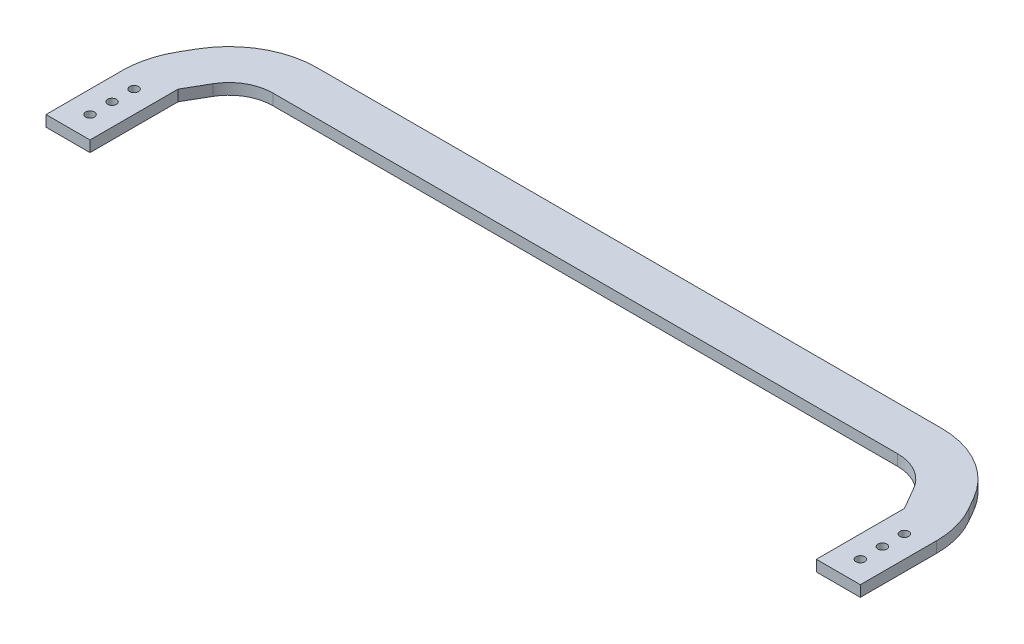
from build123d import *

# Parameters (mm, degrees)
BOSS_EXTRUDE1_DEPTH    = 6.35
F_10_CLEARANCE_HOLE1_D = 5.1054


with BuildPart() as part:
    # Sketch1 → Boss-Extrude1 (new body)
    with BuildSketch(Plane(origin=(0, 0, 0), x_dir=(1, 0, 0), z_dir=(0, 1, 0))):
        with BuildLine():
            Line((-209.55, -50.8), (-209.55, 0))
            Line((-209.55, 0), (-202.217651581, 12.7))
            ThreePointArc((-202.217651581, 12.7), (-192.920606325, 21.997045256), (-180.220606325, 25.4))
            Line((-180.220606325, 25.4), (180.220606325, 25.4))
            ThreePointArc((180.220606325, 25.4), (192.920606325, 21.997045256), (202.217651581, 12.7))
            Line((202.217651581, 12.7), (209.55, 0))
            Line((209.55, 0), (209.55, -50.8))
            Line((209.55, -50.8), (234.95, -50.8))
            Line((234.95, -50.8), (234.95, -6.805909488))
            ThreePointArc((234.95, -6.805909488), (233.219031975, 6.342098003), (228.144090512, 18.594090512))
            Line((228.144090512, 18.594090512), (224.214696837, 25.4))
            ThreePointArc((224.214696837, 25.4), (205.620606325, 43.994090512), (180.220606325, 50.8))
            Line((180.220606325, 50.8), (-180.220606325, 50.8))
            ThreePointArc((-180.220606325, 50.8), (-205.620606325, 43.994090512), (-224.214696837, 25.4))
            Line((-224.214696837, 25.4), (-228.144090512, 18.594090512))
            ThreePointArc((-228.144090512, 18.594090512), (-233.219031975, 6.342098003), (-234.95, -6.805909488))
            Line((-234.95, -6.805909488), (-234.95, -50.8))
            Line((-234.95, -50.8), (-209.55, -50.8))
        make_face()
    extrude(amount=BOSS_EXTRUDE1_DEPTH)

    # #10 Clearance Hole1 (through all)
    with Locations(Plane(origin=(0, 6.35, 0), x_dir=(1, 0, 0), z_dir=(0, 1, 0))):
        with Locations((-222.25, -38.1), (-222.25, -25.4), (-222.25, -12.7), (222.25, -12.7), (222.25, -25.4), (222.25, -38.1)):
            Hole(F_10_CLEARANCE_HOLE1_D / 2)


solid = part.part
